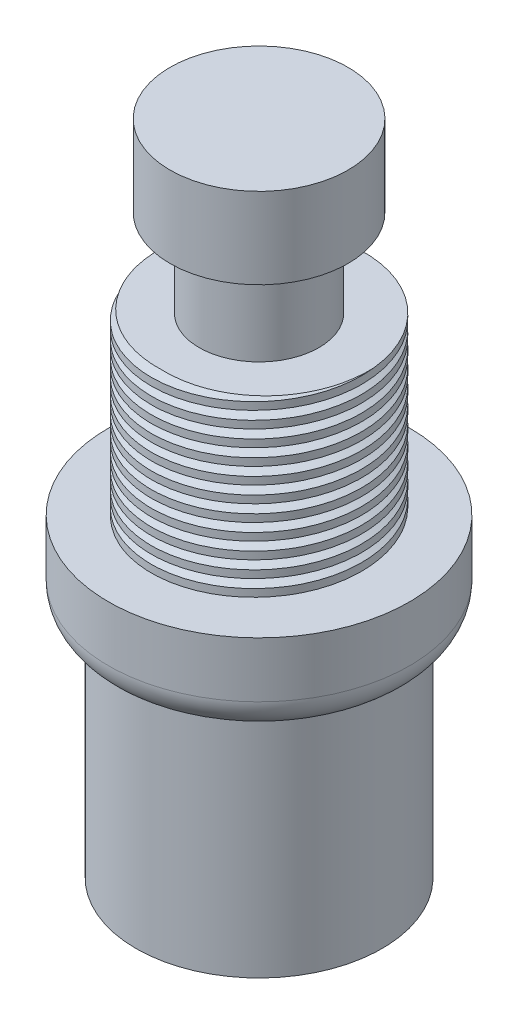
from build123d import *

# Parameters (mm, degrees)
SKETCH1_R           = 3.8
BOSS_EXTRUDE1_DEPTH = 7
SKETCH2_R           = 4.65
BOSS_EXTRUDE2_DEPTH = 2.7
SKETCH3_R           = 3.25
BOSS_EXTRUDE3_DEPTH = 5.4
CUT_SWEEP1_PITCH    = 0.5
CUT_SWEEP1_TO       = 5.4
SKETCH7_R           = 1.85
BOSS_EXTRUDE4_DEPTH = 2.7
SKETCH8_R           = 2.75
BOSS_EXTRUDE5_DEPTH = 2.5
FILLET1_R           = 1


with BuildPart() as part:
    # Sketch1 → Boss-Extrude1 (new body)
    with BuildSketch(Plane(origin=(0, 0, 0), x_dir=(1, 0, 0), z_dir=(0, 1, 0))):
        with Locations(Location((0, 0, 0), (0, 0, 270))):
            Circle(SKETCH1_R)
    extrude(amount=BOSS_EXTRUDE1_DEPTH)

    # Sketch2 → Boss-Extrude2 (add)
    with BuildSketch(Plane(origin=(0, 7, 0), x_dir=(1, 0, 0), z_dir=(0, 1, 0))):
        with Locations(Location((0, 0, 0), (0, 0, 90))):
            Circle(SKETCH2_R)
    extrude(amount=BOSS_EXTRUDE2_DEPTH)

    # Sketch3 → Boss-Extrude3 (add)
    with BuildSketch(Plane(origin=(0, 9.7, 0), x_dir=(1, 0, 0), z_dir=(0, 1, 0))):
        with Locations(Location((0, 0, 0), (0, 0, 90))):
            Circle(SKETCH3_R)
    extrude(amount=BOSS_EXTRUDE3_DEPTH)

    # Cut-Sweep1: arcs per turn and ends read off the stored shape
    # Cut-Sweep1: the profile of Sketch6 screwed along a right-hand helix through 12.666667 turns, 6 arcs to a turn; built about Z, then put on its axis
    cut_sweep1_z = Axis((0, 0, 0), (0, 0, 1))
    cut_sweep1_corners = [(3.019059892, 0, -0.5), (3.365470054, 0, -0.7), (3.365470054, 0, -0.3)]
    with BuildLine(mode=Mode.PRIVATE) as cut_sweep1_profile:
        Line(cut_sweep1_corners[0], cut_sweep1_corners[1])
        Line(cut_sweep1_corners[1], cut_sweep1_corners[2])
        Line(cut_sweep1_corners[2], cut_sweep1_corners[0])
    cut_sweep1_cap = Face(cut_sweep1_profile.wire())
    cut_sweep1_turn_angles = [0, 30, 60, 90, 120, 150, 180, 210, 240, 270, 300, 330, 360]
    cut_sweep1_turn_weights = [1, 0.8660254037844387, 1, 0.8660254037844387, 1, 0.8660254037844387, 1, 0.8660254037844387, 1, 0.8660254037844387, 1, 0.8660254037844387, 1]
    cut_sweep1_turn_rails = [Edge.make_bspline([Vector(p[0], p[1], 0).rotate(cut_sweep1_z, cut_sweep1_turn_angles[k]) / cut_sweep1_turn_weights[k] + Vector(0, 0, p[2] + CUT_SWEEP1_PITCH * cut_sweep1_turn_angles[k] / 360) for k in range(13)], [0, 0, 0, 1, 1, 2, 2, 3, 3, 4, 4, 5, 5, 6, 6, 6], 2, cut_sweep1_turn_weights) for p in cut_sweep1_corners]
    cut_sweep1_turn_sides = [Face.make_surface_from_curves(cut_sweep1_turn_rails[p[0]], cut_sweep1_turn_rails[p[1]]) for p in [(0, 1), (1, 2), (2, 0)]]
    cut_sweep1_last_angles = [4320, 4350, 4380, 4410, 4440, 4470, 4500, 4530, 4560]
    cut_sweep1_last_weights = [1, 0.8660254037844387, 1, 0.8660254037844387, 1, 0.8660254037844387, 1, 0.8660254037844387, 1]
    cut_sweep1_last_rails = [Edge.make_bspline([Vector(p[0], p[1], 0).rotate(cut_sweep1_z, cut_sweep1_last_angles[k]) / cut_sweep1_last_weights[k] + Vector(0, 0, p[2] + CUT_SWEEP1_PITCH * cut_sweep1_last_angles[k] / 360) for k in range(9)], [0, 0, 0, 1, 1, 2, 2, 3, 3, 4, 4, 4], 2, cut_sweep1_last_weights) for p in cut_sweep1_corners]
    cut_sweep1_last_sides = [Face.make_surface_from_curves(cut_sweep1_last_rails[p[0]], cut_sweep1_last_rails[p[1]]) for p in [(0, 1), (1, 2), (2, 0)]]
    cut_sweep1 = Plane(origin=(0, 15.1, 0), x_dir=(0, 0, 1), z_dir=(0, -1, 0)) * split(Solid(Shell([*[p.moved(Location((0, 0, CUT_SWEEP1_PITCH * i))) for i in range(12) for p in cut_sweep1_turn_sides], *cut_sweep1_last_sides, cut_sweep1_cap, cut_sweep1_cap.rotate(cut_sweep1_z, 4560).moved(Location((0, 0, CUT_SWEEP1_PITCH * 4560 / 360)))])), bisect_by=Plane.XY.offset(CUT_SWEEP1_TO), keep=Keep.BOTTOM, mode=Mode.PRIVATE)
    add(cut_sweep1, mode=Mode.SUBTRACT)

    # Sketch7 → Boss-Extrude4 (add)
    with BuildSketch(Plane(origin=(0, 15.1, 0), x_dir=(1, 0, 0), z_dir=(0, 1, 0))):
        with Locations(Location((0, 0, 0), (0, 0, 90))):
            Circle(SKETCH7_R)
    extrude(amount=BOSS_EXTRUDE4_DEPTH)

    # Sketch8 → Boss-Extrude5 (add)
    with BuildSketch(Plane(origin=(0, 17.8, 0), x_dir=(1, 0, 0), z_dir=(0, 1, 0))):
        with Locations(Location((0, 0, 0), (0, 0, 270))):
            Circle(SKETCH8_R)
    extrude(amount=BOSS_EXTRUDE5_DEPTH)

    # Fillet1
    # the kernel refuses this fillet: 1 mm, written as the material it takes off along each edge
    with BuildSketch(Plane(origin=(0, 7, 0), x_dir=(0, 0, -1), z_dir=(1, 0, 0))) as fillet1_piece_1:
        with BuildLine():
            CenterArc((3.65, 0.988685997), FILLET1_R, 278.626926559, 81.373073441)
            Line((3.8, 0), (3.803, -0.01977372))
            ThreePointArc((3.803, -0.01977372), (4.225, -0.02), (4.65, -0.02))
            Line((4.65, -0.02), (4.67, 0))
            Line((4.67, 0), (4.67, 0.988685997))
            Line((4.67, 0.988685997), (4.65, 0.988685997))
        make_face()
    revolve(axis=Axis((0, 7, 0), (0, 1, 0)), mode=Mode.SUBTRACT)


solid = part.part
